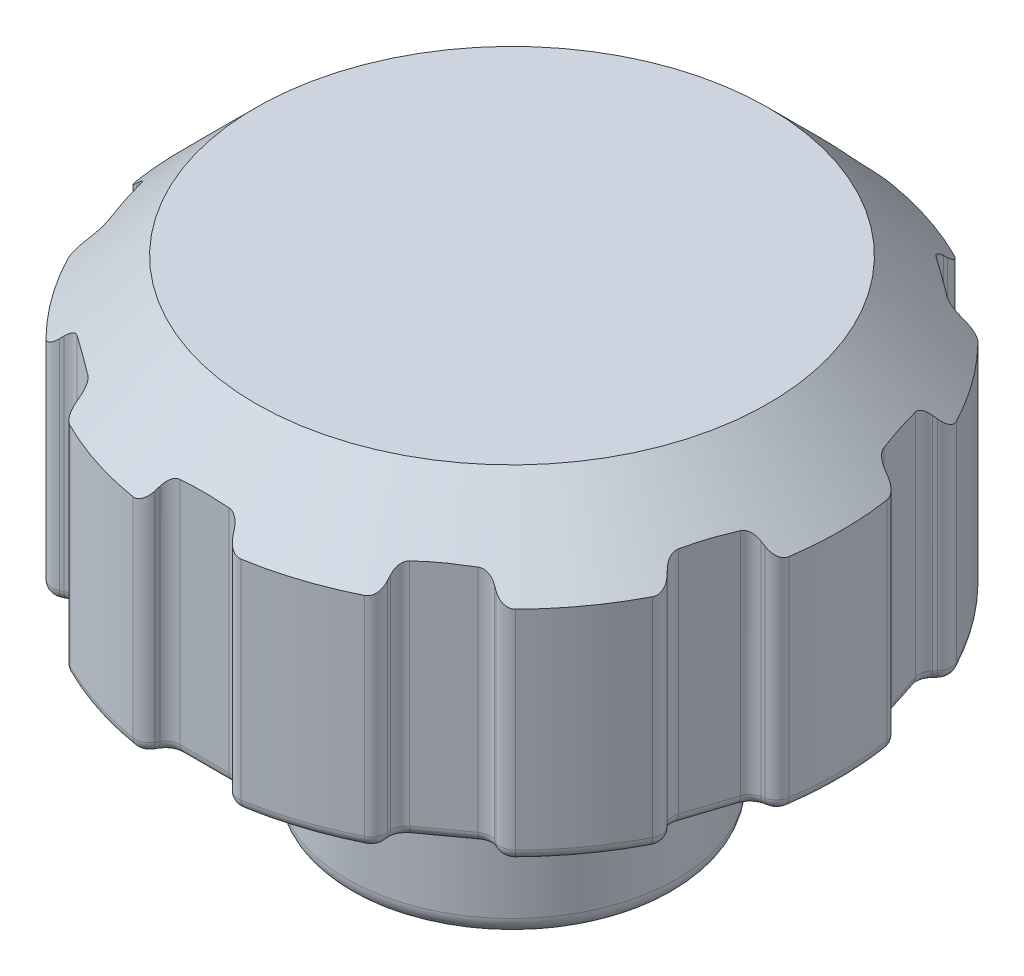
from build123d import *

# Parameters (mm, degrees)
SKIZZE1_R                       = 9
AUFSATZ_LINEAR_AUSTRAGEN1_DEPTH = 8
SKIZZE2_R                       = 4.5
AUFSATZ_LINEAR_AUSTRAGEN2_DEPTH = 5
SCHNITT_LINEAR_AUSTRAGEN2_DEPTH = 6.5
VERRUNDUNG1_SIZE                = 2
SCHNITT_LINEAR_AUSTRAGEN3_DEPTH = 19.193405399
KREISMUSTER1_COUNT              = 10
VERRUNDUNG2_R                   = 0.4
VERRUNDUNG3_R                   = 0.3
VERRUNDUNG4_R                   = 0.5
FASE1_SIZE                      = 0.7


with BuildPart() as part:
    # Skizze1 → Aufsatz-Linear austragen1 (new body)
    with BuildSketch(Plane(origin=(0, 0, 0), x_dir=(1, 0, 0), z_dir=(0, 1, 0))):
        Circle(SKIZZE1_R)
    extrude(amount=AUFSATZ_LINEAR_AUSTRAGEN1_DEPTH)

    # Skizze2 → Aufsatz-Linear austragen2 (add)
    with BuildSketch(Plane.XZ):
        Circle(SKIZZE2_R)
    extrude(amount=AUFSATZ_LINEAR_AUSTRAGEN2_DEPTH)

    # Skizze3 → Schnitt-Linear austragen2 (cut)
    with BuildSketch(Plane.XZ.offset(5)):
        with BuildLine():
            ThreePointArc((1.3, 2.703701167), (-3, 0), (1.3, -2.703701167))
            Line((1.3, -2.703701167), (1.3, 2.703701167))
        make_face()
    extrude(amount=-SCHNITT_LINEAR_AUSTRAGEN2_DEPTH, mode=Mode.SUBTRACT)

    # Verrundung1
    verrundung1_edges = [part.edges().sort_by_distance(p)[0] for p in [
        (-9, 8, 0),
    ]]
    chamfer(verrundung1_edges, length=VERRUNDUNG1_SIZE)

    # Skizze4 → Schnitt-Linear austragen3 (cut, through all)
    with BuildSketch(Plane(origin=(0, 8, 0), x_dir=(1, 0, 0), z_dir=(0, 1, 0))):
        Polygon((26.819251744, 53.29348692), (1.2, 8.919641248), (0.899984985, 8.4), (-0.899984985, 8.4), (-1.2, 8.919641248), (-26.819251744, 53.29348692), (-26.819251744, 155.770493895), (26.819251744, 155.770493895), align=None)
    schnitt_linear_austragen3 = extrude(amount=-SCHNITT_LINEAR_AUSTRAGEN3_DEPTH, mode=Mode.SUBTRACT)

    # Kreismuster1: Schnitt-Linear austragen3 ×10 about axis
    kreismuster1_axis = Axis((0, -4.6, 0), (0, 1, 0))
    for i in range(1, KREISMUSTER1_COUNT):
        add(schnitt_linear_austragen3.rotate(kreismuster1_axis, i * 360 / KREISMUSTER1_COUNT), mode=Mode.SUBTRACT)

    # Verrundung2
    verrundung2_edges = [part.edges().sort_by_distance(p)[0] for p in [
        (-1.2, 3, -8.919641248),
        (-0.899984985, 3.275962448, -8.4),
        (1.2, 3, -8.919641248),
        (0.899984985, 3.275962448, -8.4),
        (4.209292971, 3.275962448, -7.324740654),
        (4.272013188, 3, -7.921483656),
        (-4.272013188, 3, -7.921483656),
        (-4.209292971, 3.275962448, -7.324740654),
        (-5.665499267, 3.275962448, -6.266744851),
        (-6.213653975, 3, -6.510799051),
        (-8.112262539, 3, -3.897588549),
        (-7.710764082, 3.275962448, -3.451679338),
        (-8.266985392, 3.275962448, -1.739806168),
        (-8.853903326, 3, -1.61505291),
        (-8.853903326, 3, 1.61505291),
        (-8.266985392, 3.275962448, 1.739806168),
        (-7.710764082, 3.275962448, 3.451679338),
        (-8.112262539, 3, 3.897588549),
        (-6.213653975, 3, 6.510799051),
        (-5.665499267, 3.275962448, 6.266744851),
        (-4.209292971, 3.275962448, 7.324740654),
        (-4.272013188, 3, 7.921483656),
        (-1.2, 3, 8.919641248),
        (-0.899984985, 3.275962448, 8.4),
        (0.899984985, 3.275962448, 8.4),
        (1.2, 3, 8.919641248),
        (4.272013188, 3, 7.921483656),
        (4.209292971, 3.275962448, 7.324740654),
        (5.665499267, 3.275962448, 6.266744851),
        (6.213653975, 3, 6.510799051),
        (8.112262539, 3, 3.897588549),
        (7.710764082, 3.275962448, 3.451679338),
        (8.266985392, 3.275962448, 1.739806168),
        (8.853903326, 3, 1.61505291),
        (8.853903326, 3, -1.61505291),
        (8.266985392, 3.275962448, -1.739806168),
        (7.710764082, 3.275962448, -3.451679338),
        (8.112262539, 3, -3.897588549),
        (6.213653975, 3, -6.510799051),
        (5.665499267, 3.275962448, -6.266744851),
    ]]
    fillet(verrundung2_edges, radius=VERRUNDUNG2_R)

    # Verrundung3
    verrundung3_edges = [part.edges().sort_by_distance(p)[0] for p in [
        (1.239308263, 0, -8.845291924),
        (1.039589207, 0, -8.641801605),
        (0.869044878, 0, -8.453589838),
        (0, 0, -8.4),
        (-0.869044878, 0, -8.453589838),
        (-1.039589207, 0, -8.641801605),
        (-1.239308263, 0, -8.845291924),
        (-2.781152949, 0, -8.559508647),
        (-4.196510699, 0, -7.884438607),
        (-4.238478201, 0, -7.602419564),
        (-4.265823361, 0, -7.349909605),
        (-4.937396119, 0, -6.795742753),
        (-5.671967511, 0, -6.32828608),
        (-5.920568872, 0, -6.380309156),
        (-6.201753591, 0, -6.427544366),
        (-7.281152949, 0, -5.290067271),
        (-8.029405208, 0, -3.911997724),
        (-7.897590996, 0, -3.659171647),
        (-7.771292066, 0, -3.438813717),
        (-7.988874737, 0, -2.595742753),
        (-8.308391338, 0, -1.78579213),
        (-8.540092461, 0, -1.681755468),
        (-8.795339837, 0, -1.554693325),
        (-9, 0, 0),
        (-8.795339837, 0, 1.554693325),
        (-8.540092461, 0, 1.681755468),
        (-8.308391338, 0, 1.78579213),
        (-7.988874737, 0, 2.595742753),
        (-7.771292066, 0, 3.438813717),
        (-7.897590996, 0, 3.659171647),
        (-8.029405208, 0, 3.911997724),
        (-7.281152949, 0, 5.290067271),
        (-6.201753591, 0, 6.427544366),
        (-5.920568872, 0, 6.380309156),
        (-5.671967511, 0, 6.32828608),
        (-4.937396119, 0, 6.795742753),
        (-4.265823361, 0, 7.349909605),
        (-4.238478201, 0, 7.602419564),
        (-4.196510699, 0, 7.884438607),
        (-2.781152949, 0, 8.559508647),
        (-1.239308263, 0, 8.845291924),
        (-1.039589207, 0, 8.641801605),
        (-0.869044878, 0, 8.453589838),
        (0, 0, 8.4),
        (0.869044878, 0, 8.453589838),
        (1.039589207, 0, 8.641801605),
        (1.239308263, 0, 8.845291924),
        (2.781152949, 0, 8.559508647),
        (4.196510699, 0, 7.884438607),
        (4.238478201, 0, 7.602419564),
        (4.265823361, 0, 7.349909605),
        (4.937396119, 0, 6.795742753),
        (5.671967511, 0, 6.32828608),
        (5.920568872, 0, 6.380309156),
        (6.201753591, 0, 6.427544366),
        (7.281152949, 0, 5.290067271),
        (8.029405208, 0, 3.911997724),
        (7.897590996, 0, 3.659171647),
        (7.771292066, 0, 3.438813717),
        (7.988874737, 0, 2.595742753),
        (8.308391338, 0, 1.78579213),
        (8.540092461, 0, 1.681755468),
        (8.795339837, 0, 1.554693325),
        (9, 0, 0),
        (8.795339837, 0, -1.554693325),
        (8.540092461, 0, -1.681755468),
        (8.308391338, 0, -1.78579213),
        (7.988874737, 0, -2.595742753),
        (7.771292066, 0, -3.438813717),
        (7.897590996, 0, -3.659171647),
        (8.029405208, 0, -3.911997724),
        (7.281152949, 0, -5.290067271),
        (6.201753591, 0, -6.427544366),
        (5.920568872, 0, -6.380309156),
        (5.671967511, 0, -6.32828608),
        (4.937396119, 0, -6.795742753),
        (4.265823361, 0, -7.349909605),
        (4.238478201, 0, -7.602419564),
        (4.196510699, 0, -7.884438607),
        (2.781152949, 0, -8.559508647),
        (-4.5, 0, 0),
    ]]
    fillet(verrundung3_edges, radius=VERRUNDUNG3_R)

    # Verrundung4
    verrundung4_edges = [part.edges().sort_by_distance(p)[0] for p in [
        (-4.5, -5, 0),
    ]]
    fillet(verrundung4_edges, radius=VERRUNDUNG4_R)

    # Fase1
    fase1_edges = [part.edges().sort_by_distance(p)[0] for p in [
        (1.3, -5, 0),
        (-3, -5, 0),
    ]]
    chamfer(fase1_edges, length=FASE1_SIZE)


solid = part.part
